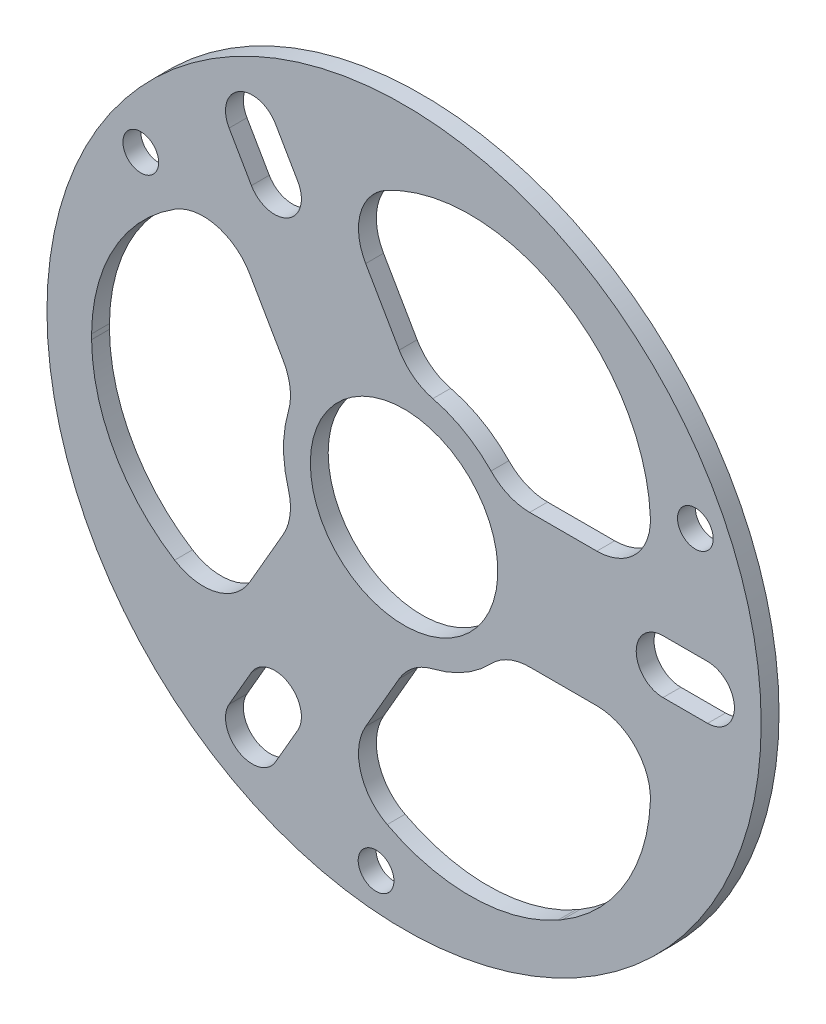
from build123d import *

# Parameters (mm, degrees)
SKETCH1_R                = 40
SKETCH1_R_2              = 35
BOSS_EXTRUDE1_DEPTH      = 2
BOSS_EXTRUDE2_DEPTH      = 2
SKETCH3_R                = 3
CUT_EXTRUDE1_DEPTH       = 2
FILLET1_DEPTH            = 2
SKETCH4_R                = 2
CUT_EXTRUDE2_DEPTH       = 10
BOSS_EXTRUDE3_START      = -2
BOSS_EXTRUDE3_DEPTH      = 2
BOSS_EXTRUDE4_START      = -2
SKETCH7_R                = 13.5
SKETCH7_R_2              = 10.5
BOSS_EXTRUDE4_DEPTH      = 2
FILLET2_R                = 6
CIRPATTERN1_COUNT        = 3
FILLET2_OF_CIRPATTERN1_R = 6


with BuildPart() as part:
    # Sketch1 → Boss-Extrude1 (new body)
    with BuildSketch(Plane.XY):
        Circle(SKETCH1_R)
        Circle(SKETCH1_R_2, mode=Mode.SUBTRACT)
    extrude(amount=BOSS_EXTRUDE1_DEPTH)

    # Sketch2 → Boss-Extrude2 (add)
    with BuildSketch(Plane(origin=(0, 0, 0), x_dir=(-1, 0, 0), z_dir=(0, 0, -1))):
        with BuildLine():
            Line((-29, 5), (-34.641016151, 5))
            Line((-34.641016151, 5), (-37.165171868, 5))
            ThreePointArc((-37.165171868, 5), (-37.5, 0), (-37.165171868, -5))
            Line((-37.165171868, -5), (-29, -5))
            ThreePointArc((-29, -5), (-24, 0), (-29, 5))
        make_face()
        with BuildLine():
            Line((-34, -3), (-29, -3))
            ThreePointArc((-29, -3), (-26, 0), (-29, 3))
            Line((-29, 3), (-34, 3))
            ThreePointArc((-34, 3), (-37, 0), (-34, -3))
        make_face(mode=Mode.SUBTRACT)
    boss_extrude2 = extrude(amount=-BOSS_EXTRUDE2_DEPTH)

    # Sketch3 → Cut-Extrude1 (cut)
    with BuildSketch(Plane(origin=(0, 0, 0), x_dir=(-1, 0, 0), z_dir=(0, 0, -1))):
        with Locations((-34, 0)):
            Circle(SKETCH3_R)
    cut_extrude1 = extrude(amount=-CUT_EXTRUDE1_DEPTH, mode=Mode.SUBTRACT)

    # Fillet1: read off the stored shape, not the designer's step
    # Fillet1 outline → Fillet1 (add)
    with BuildSketch(Plane.XY):
        with BuildLine():
            ThreePointArc((29, -5), (26.543386825, -4.354888254), (24.720689655, -2.586020683))
            ThreePointArc((24.720689655, -2.586020683), (26.992450638, -17.835874241), (17.74137931, -30.170241301))
            ThreePointArc((17.74137931, -30.170241301), (29.057943842, -19.509892353), (34.641016151, -5))
            Line((34.641016151, -5), (29, -5))
        make_face()
        with BuildLine():
            ThreePointArc((17.74137931, 30.170241301), (26.992450638, 17.835874241), (24.720689655, 2.586020683))
            ThreePointArc((24.720689655, 2.586020683), (26.543386825, 4.354888254), (29, 5))
            Line((29, 5), (34.641016151, 5))
            ThreePointArc((34.641016151, 5), (29.057943842, 19.509892353), (17.74137931, 30.170241301))
        make_face()
    fillet1 = extrude(amount=FILLET1_DEPTH)

    # Sketch4 → Cut-Extrude2 (cut)
    with BuildSketch(Plane.XY.offset(2)):
        with Locations((32.627080333, 15.214257423)):
            Circle(SKETCH4_R)
    cut_extrude2 = extrude(amount=-CUT_EXTRUDE2_DEPTH, mode=Mode.SUBTRACT)

    # Sketch5 → Boss-Extrude3 (add)
    with BuildSketch(Plane.XY.offset(2).offset(BOSS_EXTRUDE3_START)):
        with BuildLine():
            Line((7.348469228, 7.5), (34.186985828, 7.5))
            ThreePointArc((34.186985828, 7.5), (34.60231879, 5.261134323), (34.871191548, 3))
            Line((34.871191548, 3), (29, 3))
            ThreePointArc((29, 3), (26, 0), (29, -3))
            Line((29, -3), (34.871191548, -3))
            ThreePointArc((34.871191548, -3), (34.60231879, -5.261134323), (34.186985828, -7.5))
            Line((34.186985828, -7.5), (7.348469228, -7.5))
            ThreePointArc((7.348469228, -7.5), (10.5, 0), (7.348469228, 7.5))
        make_face()
    boss_extrude3 = extrude(amount=BOSS_EXTRUDE3_DEPTH)

    # Sketch7 → Boss-Extrude4 (add)
    with BuildSketch(Plane.XY.offset(2).offset(BOSS_EXTRUDE4_START)):
        Circle(SKETCH7_R)
        with Locations(Location((0, 0, 0), (0, 0, 180))):
            Circle(SKETCH7_R_2, mode=Mode.SUBTRACT)
    extrude(amount=BOSS_EXTRUDE4_DEPTH)

    # Fillet2
    fillet2_edges = [part.edges().sort_by_distance(p)[0] for p in [
        (11.22497216, 7.5, 1),
        (11.22497216, -7.5, 1),
        (26.852187894, 7.5, 1),
        (26.852187894, -7.5, 1),
    ]]
    fillet(fillet2_edges, radius=FILLET2_R)

    # CirPattern1: Boss-Extrude2, Cut-Extrude1, Fillet1, Cut-Extrude2, Boss-Extrude3 ×3 about axis
    cirpattern1_axis = Axis((0, 0, 0), (0, 0, 1))
    add([boss_extrude2.rotate(cirpattern1_axis, i * 360 / CIRPATTERN1_COUNT) for i in range(1, CIRPATTERN1_COUNT)])
    add([cut_extrude1.rotate(cirpattern1_axis, i * 360 / CIRPATTERN1_COUNT) for i in range(1, CIRPATTERN1_COUNT)], mode=Mode.SUBTRACT)
    add([fillet1.rotate(cirpattern1_axis, i * 360 / CIRPATTERN1_COUNT) for i in range(1, CIRPATTERN1_COUNT)])
    add([cut_extrude2.rotate(cirpattern1_axis, i * 360 / CIRPATTERN1_COUNT) for i in range(1, CIRPATTERN1_COUNT)], mode=Mode.SUBTRACT)
    add([boss_extrude3.rotate(cirpattern1_axis, i * 360 / CIRPATTERN1_COUNT) for i in range(1, CIRPATTERN1_COUNT)])

    # Fillet2 of CirPattern1
    fillet2_of_cirpattern1_edges = [part.edges().sort_by_distance(p)[0] for p in [
        (-12.107676609, 5.971111048, 1),
        (0.882704448, 13.471111048, 1),
        (-19.921284476, 19.504676864, 1),
        (-6.930903419, 27.004676864, 1),
        (0.882704448, -13.471111048, 1),
        (-12.107676609, -5.971111048, 1),
        (-6.930903419, -27.004676864, 1),
        (-19.921284476, -19.504676864, 1),
    ]]
    fillet(fillet2_of_cirpattern1_edges, radius=FILLET2_OF_CIRPATTERN1_R)


solid = part.part
